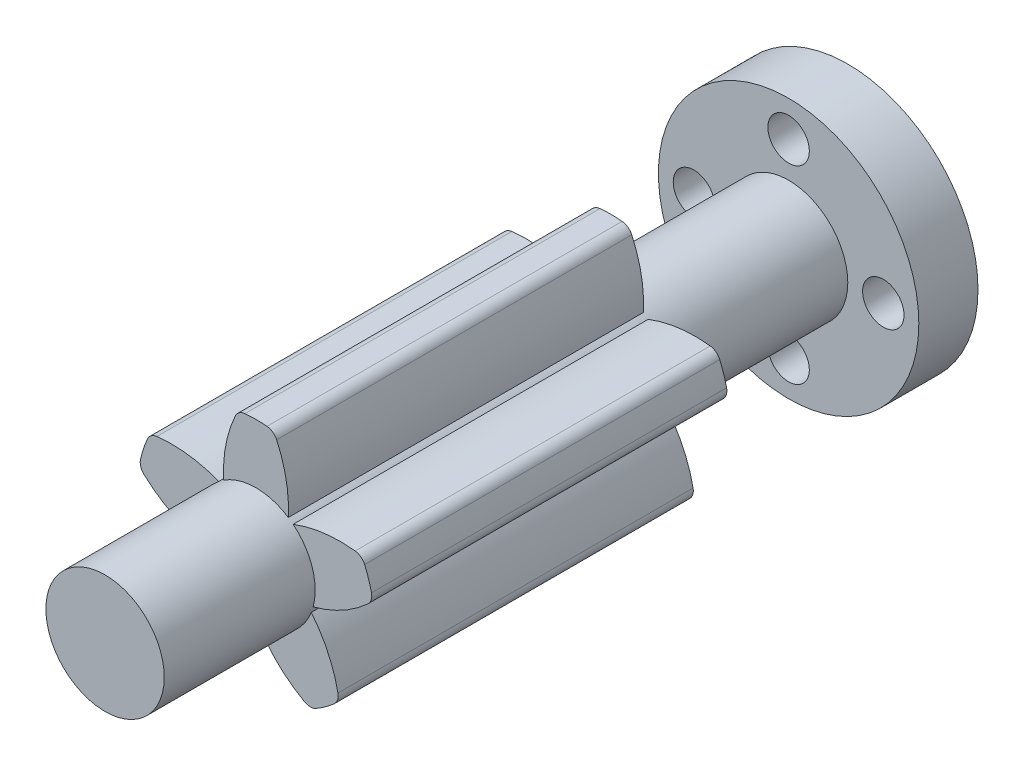
from build123d import *

# Parameters (mm, degrees)
ESQUISSE1_R                        = 11
BOSS_EXTRU_1_DEPTH                 = 5
ENL_V_MAT_EXTRU_1_DEPTH            = 17.340134638
ESQUISSE3_R                        = 5
BOSS_EXTRU_2_DEPTH                 = 57.75
BOSS_EXTRU_3_DEPTH                 = 15
CONG_1_R                           = 1
R_P_TITION_CIRCULAIRE1_COUNT       = 5
CONG_1_OF_R_P_TITION_CIRCULAIRE1_R = 1
ESQUISSE3D1_R                      = 1.75
ENL_V_MAT_EXTRU_2_DEPTH            = 2.5
ENL_V_MAT_EXTRU_3_OUTLINE_R        = 1
ENL_V_MAT_EXTRU_3_DEPTH            = 2.5


# Read off the part's stored shape, not the designer's step: Enlèv. mat.-Extru.3
with BuildPart() as part:
    # Esquisse1 → Boss.-Extru.1 (new body)
    with BuildSketch(Plane.XY):
        Circle(ESQUISSE1_R)
    extrude(amount=BOSS_EXTRU_1_DEPTH)

    # Esquisse2 → Enlèv. mat.-Extru.1 (cut, through all)
    with BuildSketch(Plane.XY.offset(5)):
        with BuildLine():
            ThreePointArc((1, 8), (0.707106781, 8.707106781), (0, 9))
            Line((0, 9), (0, 8))
            ThreePointArc((0, 8), (0.5, 7.984359711), (0.998044964, 7.9375))
            ThreePointArc((0.998044964, 7.9375), (0.999511121, 7.968734715), (1, 8))
        make_face()
        with BuildLine():
            Line((0, 8), (0, 9))
            ThreePointArc((0, 9), (-0.728868987, 8.684653197), (-0.998044964, 7.9375))
            ThreePointArc((-0.998044964, 7.9375), (-0.5, 7.984359711), (0, 8))
        make_face()
        with BuildLine():
            ThreePointArc((0.998044964, 7.9375), (0.5, 7.984359711), (0, 8))
            Line((0, 8), (0, 7))
            ThreePointArc((0, 7), (0.684653197, 7.271131013), (0.998044964, 7.9375))
        make_face()
        with BuildLine():
            Line((0, 7), (0, 8))
            ThreePointArc((0, 8), (-0.5, 7.984359711), (-0.998044964, 7.9375))
            ThreePointArc((-0.998044964, 7.9375), (-0.684653197, 7.271131013), (0, 7))
        make_face()
        with BuildLine():
            ThreePointArc((0, -7), (-0.684653197, -7.271131013), (-0.998044964, -7.9375))
            ThreePointArc((-0.998044964, -7.9375), (-0.5, -7.984359711), (0, -8))
            Line((0, -8), (0, -7))
        make_face()
        with BuildLine():
            ThreePointArc((0, -8), (-0.5, -7.984359711), (-0.998044964, -7.9375))
            ThreePointArc((-0.998044964, -7.9375), (-0.728868987, -8.684653197), (0, -9))
            Line((0, -9), (0, -8))
        make_face()
        with BuildLine():
            ThreePointArc((0.998044964, -7.9375), (0.684653197, -7.271131013), (0, -7))
            Line((0, -7), (0, -8))
            ThreePointArc((0, -8), (0.5, -7.984359711), (0.998044964, -7.9375))
        make_face()
        with BuildLine():
            ThreePointArc((0.998044964, -7.9375), (0.5, -7.984359711), (0, -8))
            Line((0, -8), (0, -9))
            ThreePointArc((0, -9), (0.707106781, -8.707106781), (1, -8))
            ThreePointArc((1, -8), (0.999511121, -7.968734715), (0.998044964, -7.9375))
        make_face()
    extrude(amount=-ENL_V_MAT_EXTRU_1_DEPTH, mode=Mode.SUBTRACT)

    # Esquisse3 → Boss.-Extru.2 (add)
    with BuildSketch(Plane.XY.offset(5)):
        Circle(ESQUISSE3_R)
    extrude(amount=BOSS_EXTRU_2_DEPTH)

    # Esquisse4 → Boss.-Extru.3 (add, symmetric)
    with BuildSketch(Plane.XY.offset(35)):
        with BuildLine():
            ThreePointArc((-2.731158071, 4.188170912), (-2.5, 7.120566641), (-1.5, 9.886859967))
            ThreePointArc((-1.5, 9.886859967), (0, 10), (1.5, 9.886859967))
            ThreePointArc((1.5, 9.886859967), (2.5, 7.120566641), (2.731158071, 4.188170912))
            ThreePointArc((2.731158071, 4.188170912), (0, -5), (-2.731158071, 4.188170912))
        make_face()
    boss_extru_3 = extrude(amount=BOSS_EXTRU_3_DEPTH, both=True)

    # Congé1
    cong_1_edges = [part.edges().sort_by_distance(p)[0] for p in [
        (1.5, 9.886859967, 35),
        (-1.5, 9.886859967, 35),
    ]]
    fillet(cong_1_edges, radius=CONG_1_R)

    # Répétition circulaire1: Boss.-Extru.3 ×5 about axis
    r_p_tition_circulaire1_axis = Axis((0, 0, 0), (0, 0, 1))
    for i in range(1, R_P_TITION_CIRCULAIRE1_COUNT):
        add(boss_extru_3.rotate(r_p_tition_circulaire1_axis, i * 360 / R_P_TITION_CIRCULAIRE1_COUNT))

    # Congé1 of Répétition circulaire1
    cong_1_of_r_p_tition_circulaire1_edges = [part.edges().sort_by_distance(p)[0] for p in [
        (-8.939437105, 4.481792525, 35),
        (-9.866488089, 1.628622976, 35),
        (-7.024875971, -7.116959856, 35),
        (-4.597824988, -8.880315612, 35),
        (4.597824988, -8.880315612, 35),
        (7.024875971, -7.116959856, 35),
        (9.866488089, 1.628622976, 35),
        (8.939437105, 4.481792525, 35),
    ]]
    fillet(cong_1_of_r_p_tition_circulaire1_edges, radius=CONG_1_OF_R_P_TITION_CIRCULAIRE1_R)

    # Esquisse3D1 → Enlèv. mat.-Extru.2 (cut)
    with BuildSketch(Plane(origin=(0, -8, 5), x_dir=(0, 1, 0), z_dir=(-7.673874556635152e-12, 0, -1.0))):
        with Locations(Location((0, 0, 0), (0, 0, 90))):
            Circle(ESQUISSE3D1_R)
        with Locations(Location((8, 8, 0), (0, 0, 270))):
            Circle(ESQUISSE3D1_R)
        with Locations(Location((8, -8, 0), (0, 0, 270))):
            Circle(ESQUISSE3D1_R)
        with Locations(Location((16, 0, 0), (0, 0, 90))):
            Circle(ESQUISSE3D1_R)
    extrude(amount=ENL_V_MAT_EXTRU_2_DEPTH, mode=Mode.SUBTRACT)

    # Enlèv. mat.-Extru.3 outline → Enlèv. mat.-Extru.3 (cut)
    with BuildSketch(Plane.XY):
        with Locations((8, 0)):
            Circle(ENL_V_MAT_EXTRU_3_OUTLINE_R)
        with Locations((-8, 0)):
            Circle(ENL_V_MAT_EXTRU_3_OUTLINE_R)
    extrude(amount=ENL_V_MAT_EXTRU_3_DEPTH, mode=Mode.SUBTRACT)


solid = part.part
